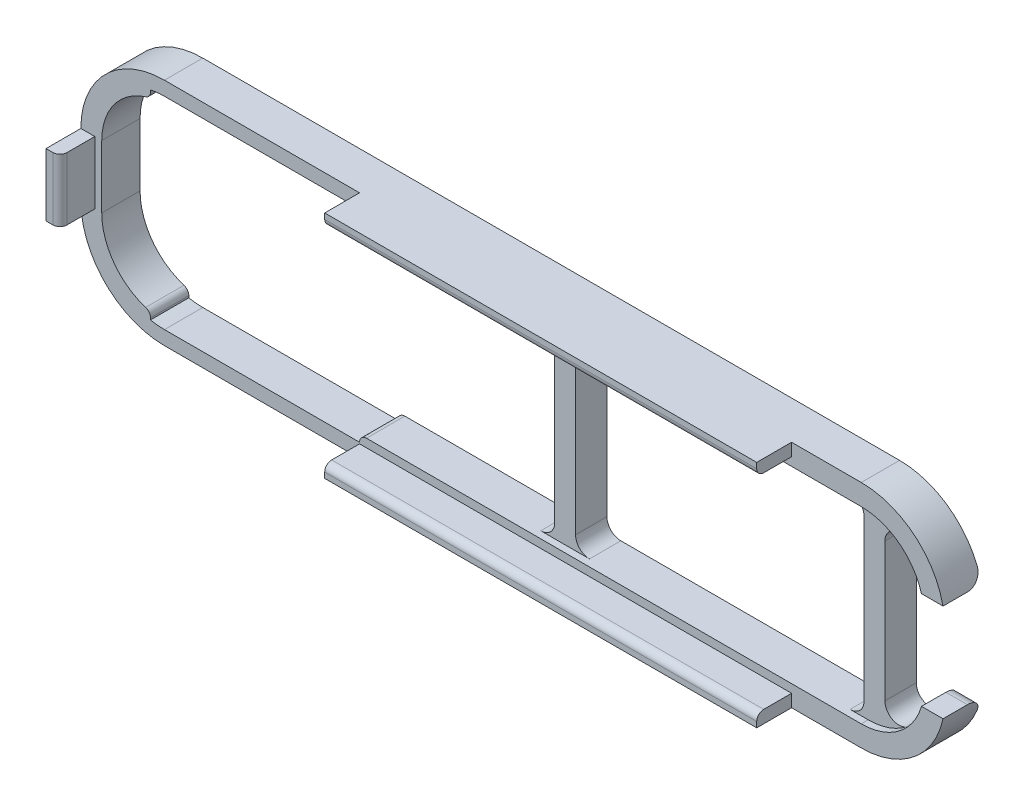
from build123d import *

# Parameters (mm, degrees)
BOSS_EXTRUDE2_DEPTH                    = 5.5
SKETCH4_W                              = 3
SKETCH4_H                              = 27
BOSS_EXTRUDE4_CROSS_STRUCTURES_DEPTH   = 5.5
SKETCH6_W                              = 3
SKETCH6_H                              = 27
CUT_EXTRUDE3_1_MM_SPACING_DEPTH        = 1
CUT_EXTRUDE4_ELECTRONICS_SPACING_DEPTH = 124.233518168
SKETCH8_W                              = 5.5
SKETCH8_H                              = 14
CUT_EXTRUDE2_USB_C_CUTOUT_DEPTH        = 5
FILLET2_USBC_R                         = 2
FILLET3_INNER_CORNERS_FRONT_R          = 1
FILLET5_INNER_CORNERS_R                = 2
SKETCH18_W                             = 62
SKETCH18_H                             = 1.8
SKETCH18_W_2                           = 2
SKETCH18_H_2                           = 9
BOSS_EXTRUDE7_DEPTH                    = 5
FILLET1_R                              = 1


with BuildPart() as part:
    # Sketch3 → Boss-Extrude2 (new body)
    with BuildSketch(Plane.XY.offset(-1.6194024)):
        with BuildLine():
            Line((110, 16.5), (10, 16.5))
            ThreePointArc((10, 16.5), (1.514718626, 12.985281374), (-2, 4.5))
            Line((-2, 4.5), (-2, -4.5))
            ThreePointArc((-2, -4.5), (1.514718626, -12.985281374), (10, -16.5))
            Line((10, -16.5), (110, -16.5))
            ThreePointArc((110, -16.5), (118.485281374, -12.985281374), (122, -4.5))
            Line((122, -4.5), (122, 4.5))
            ThreePointArc((122, 4.5), (118.485281374, 12.985281374), (110, 16.5))
        make_face()
        with BuildLine():
            Line((119, -4.5), (119, 4.5))
            ThreePointArc((119, 4.5), (116.363961031, 10.863961031), (110, 13.5))
            Line((110, 13.5), (10, 13.5))
            ThreePointArc((10, 13.5), (3.636038969, 10.863961031), (1, 4.5))
            Line((1, 4.5), (1, -4.5))
            ThreePointArc((1, -4.5), (3.636038969, -10.863961031), (10, -13.5))
            Line((10, -13.5), (110, -13.5))
            ThreePointArc((110, -13.5), (116.363961031, -10.863961031), (119, -4.5))
        make_face(mode=Mode.SUBTRACT)
    extrude(amount=-BOSS_EXTRUDE2_DEPTH)

    # Sketch4 → Boss-Extrude4 - cross structures (add)
    with BuildSketch(Plane.XY.offset(-1.6194024)):
        with Locations((110.9, 0)):
            Rectangle(SKETCH4_W, SKETCH4_H)
        with Locations((66.5, 0)):
            Rectangle(SKETCH4_W, SKETCH4_H)
    extrude(amount=-BOSS_EXTRUDE4_CROSS_STRUCTURES_DEPTH)

    # Sketch6 → Cut-Extrude3 - 1 mm spacing (cut)
    with BuildSketch(Plane.XY.offset(-1.6194024)):
        with BuildLine():
            Line((109.4, 13.5), (110, 13.5))
            ThreePointArc((110, 13.5), (111.211013131, 13.418152678), (112.4, 13.174099377))
            Line((112.4, 13.174099377), (112.4, -13.174099377))
            ThreePointArc((112.4, -13.174099377), (111.211013131, -13.418152678), (110, -13.5))
            Line((110, -13.5), (109.4, -13.5))
            Line((109.4, -13.5), (109.4, 13.5))
        make_face()
        with Locations((66.5, 0)):
            Rectangle(SKETCH6_W, SKETCH6_H)
    extrude(amount=-CUT_EXTRUDE3_1_MM_SPACING_DEPTH, mode=Mode.SUBTRACT)

    # Sketch7 → Cut-Extrude4 - electronics spacing (cut, through all)
    with BuildSketch(Plane.XY.offset(-1.6194024)):
        with BuildLine():
            Line((38, -14.5), (10, -14.5))
            ThreePointArc((10, -14.5), (8.99491038, -14.44936153), (8, -14.297958971))
            Line((8, -14.297958971), (8, 14.297958971))
            ThreePointArc((8, 14.297958971), (8.99491038, 14.44936153), (10, 14.5))
            Line((10, 14.5), (38, 14.5))
            Line((38, 14.5), (38, -14.5))
        make_face()
    extrude(amount=-CUT_EXTRUDE4_ELECTRONICS_SPACING_DEPTH, mode=Mode.SUBTRACT)

    # Sketch8 → Cut-Extrude2 - USB-C cutout (cut)
    with BuildSketch(Plane(origin=(122, 0, 0), x_dir=(0, 0, -1), z_dir=(1, 0, 0))):
        with Locations((4.3694024, 0)):
            Rectangle(SKETCH8_W, SKETCH8_H)
    extrude(amount=-CUT_EXTRUDE2_USB_C_CUTOUT_DEPTH, mode=Mode.SUBTRACT)

    # Fillet2 - USBC
    fillet2_usbc_edges = [part.edges().sort_by_distance(p)[0] for p in [
        (120.191251414, 7, -7.1194024),
        (120.191251414, -7, -7.1194024),
    ]]
    fillet(fillet2_usbc_edges, radius=FILLET2_USBC_R)

    # Fillet3 - inner corners, front
    fillet3_inner_corners_front_edges = [part.edges().sort_by_distance(p)[0] for p in [
        (38, 13.5, -4.3694024),
        (38, -13.5, -4.3694024),
        (8, -13.274964387, -4.3694024),
        (8, 13.274964387, -4.3694024),
    ]]
    fillet(fillet3_inner_corners_front_edges, radius=FILLET3_INNER_CORNERS_FRONT_R - 0.0001)  # a hair under: the kernel refuses the full size

    # Fillet5 - inner corners
    fillet5_inner_corners_edges = [part.edges().sort_by_distance(p)[0] for p in [
        (112.4, -13.174099377, -4.8694024),
        (109.4, -13.5, -4.8694024),
        (109.4, 13.5, -4.8694024),
        (65, -13.5, -4.8694024),
        (65, 13.5, -4.8694024),
        (68, 13.5, -4.8694024),
        (68, -13.5, -4.8694024),
        (112.4, 13.174099377, -4.8694024),
    ]]
    fillet(fillet5_inner_corners_edges, radius=FILLET5_INNER_CORNERS_R)

    # Sketch18 → Boss-Extrude7 (add)
    with BuildSketch(Plane.XY.offset(-1.6194024)):
        with Locations((69, 15.6)):
            Rectangle(SKETCH18_W, SKETCH18_H)
        with Locations((69, -15.6)):
            Rectangle(SKETCH18_W, SKETCH18_H)
        with Locations((-1, 0)):
            Rectangle(SKETCH18_W_2, SKETCH18_H_2)
    extrude(amount=BOSS_EXTRUDE7_DEPTH)

    # Fillet1
    fillet1_edges = [part.edges().sort_by_distance(p)[0] for p in [
        (69, 14.7, 3.3805976),
        (69, -14.7, 3.3805976),
        (0, 0, 3.3805976),
    ]]
    fillet(fillet1_edges, radius=FILLET1_R)


solid = part.part
